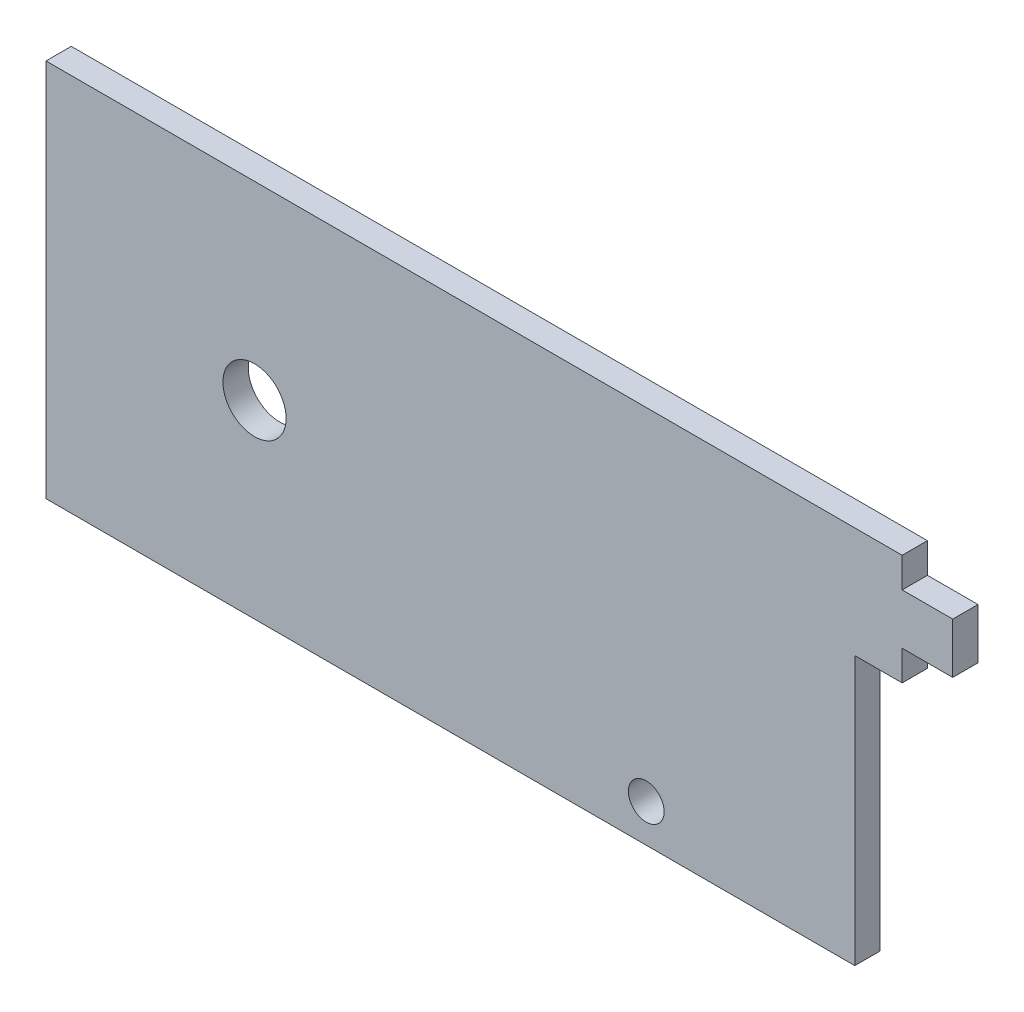
from build123d import *

# Parameters (mm, degrees)
SKETCH1_R           = 5
SKETCH1_R_2         = 2.83
BOSS_EXTRUDE1_DEPTH = 4


with BuildPart() as part:
    # Sketch1 → Boss-Extrude1 (new body)
    with BuildSketch(Plane.XY):
        Polygon((47, 30), (54.5, 30), (54.5, 25.25), (62.5, 25.25), (62.5, 17.25), (54.5, 17.25), (54.5, 12.5), (47, 12.5), (47, -30), (-81, -30), (-81, 30), align=None)
        with Locations((-48, 0)):
            Circle(SKETCH1_R, mode=Mode.SUBTRACT)
        with Locations((14, -24)):
            Circle(SKETCH1_R_2, mode=Mode.SUBTRACT)
    extrude(amount=BOSS_EXTRUDE1_DEPTH)


solid = part.part
